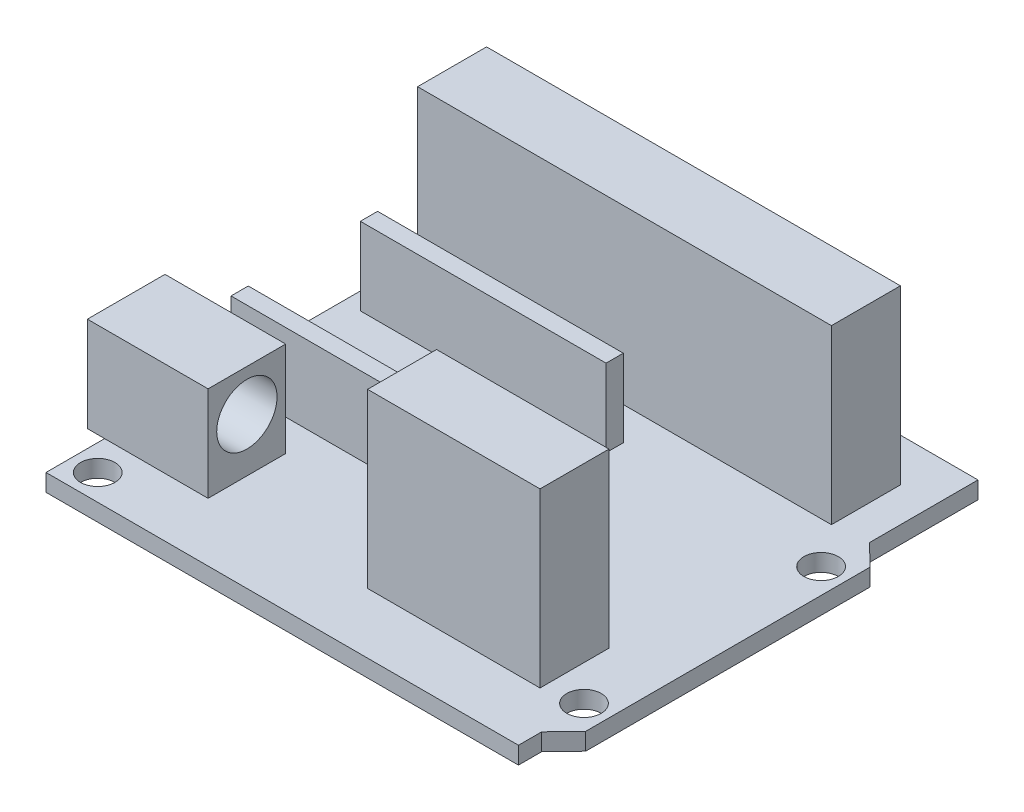
from build123d import *

# Parameters (mm, degrees)
SKETCH1_R           = 2
BOSS_EXTRUDE1_DEPTH = 2
SKETCH2_W           = 28.5
SKETCH2_H           = 2
BOSS_EXTRUDE2_DEPTH = 9
LPATTERN1_COUNT     = 2
LPATTERN1_PITCH     = 15
SKETCH3_W           = 20
SKETCH3_H           = 8
BOSS_EXTRUDE3_DEPTH = 20
SKETCH4_W           = 48
SKETCH4_H           = 8
BOSS_EXTRUDE4_DEPTH = 20
SKETCH5_W           = 9
SKETCH5_H           = 11
SKETCH5_R           = 3.5
BOSS_EXTRUDE5_DEPTH = 14
SKETCH6_R           = 0.5
BOSS_EXTRUDE6_DEPTH = 2.2
LPATTERN2_COUNT     = 2
LPATTERN2_PITCH     = 5
LPATTERN3_COUNT     = 2
LPATTERN3_PITCH     = 5


with BuildPart() as part:
    # Sketch1 → Boss-Extrude1 (new body)
    with BuildSketch(Plane(origin=(0, 0, 0), x_dir=(1, 0, 0), z_dir=(0, 1, 0))):
        Polygon((54.8, 40.7), (54.8, 53.3), (0, 53.3), (0, 0), (54.8, 0), (54.8, 2.695833333), (57.3, 5.3), (57.3, 38.3), align=None)
        with Locations((3, 3)):
            Circle(SKETCH1_R, mode=Mode.SUBTRACT)
        with Locations((54.4, 8)):
            Circle(SKETCH1_R, mode=Mode.SUBTRACT)
        with Locations((4, 50.8)):
            Circle(SKETCH1_R, mode=Mode.SUBTRACT)
        with Locations((54.4, 35.5)):
            Circle(SKETCH1_R, mode=Mode.SUBTRACT)
    extrude(amount=BOSS_EXTRUDE1_DEPTH)

    # Sketch2 → Boss-Extrude2 (add)
    with BuildSketch(Plane(origin=(0, 2, 0), x_dir=(1, 0, 0), z_dir=(0, 1, 0))):
        with Locations((16.25, 35.460185898)):
            Rectangle(SKETCH2_W, SKETCH2_H)
    boss_extrude2 = extrude(amount=BOSS_EXTRUDE2_DEPTH)

    # LPattern1: Boss-Extrude2 ×2
    with Locations(*[(0, 0, i * LPATTERN1_PITCH) for i in range(1, LPATTERN1_COUNT)]):
        add(boss_extrude2)

    # Sketch3 → Boss-Extrude3 (add)
    with BuildSketch(Plane(origin=(0, 2, 0), x_dir=(1, 0, 0), z_dir=(0, 1, 0))):
        with Locations((40.3, 11)):
            Rectangle(SKETCH3_W, SKETCH3_H)
    extrude(amount=BOSS_EXTRUDE3_DEPTH)

    # Sketch4 → Boss-Extrude4 (add)
    with BuildSketch(Plane(origin=(0, 2, 0), x_dir=(1, 0, 0), z_dir=(0, 1, 0))):
        with Locations((26.8, 44.3)):
            Rectangle(SKETCH4_W, SKETCH4_H)
    extrude(amount=BOSS_EXTRUDE4_DEPTH)

    # Sketch5 → Boss-Extrude5 (add)
    with BuildSketch(Plane.ZY.offset(2)):
        with Locations((-11.3, 7.5)):
            Rectangle(SKETCH5_W, SKETCH5_H)
        with Locations((-11.3, 8.2)):
            Circle(SKETCH5_R, mode=Mode.SUBTRACT)
    extrude(amount=-BOSS_EXTRUDE5_DEPTH)

    # Sketch6 → Boss-Extrude6 (add)
    with BuildSketch(Plane.XZ):
        with Locations((6.488337658, -7.768048355)):
            Circle(SKETCH6_R)
    boss_extrude6 = extrude(amount=BOSS_EXTRUDE6_DEPTH)

    # LPattern2: Boss-Extrude6 ×2
    with Locations(*[Vector(0.9316516014644738, 0, -0.36335284984252075) * (i * LPATTERN2_PITCH) for i in range(1, LPATTERN2_COUNT)]):
        add(boss_extrude6)

    # LPattern3: Boss-Extrude6 ×2
    with Locations(*[(0, 0, -i * LPATTERN3_PITCH) for i in range(1, LPATTERN3_COUNT)]):
        add(boss_extrude6)


solid = part.part
